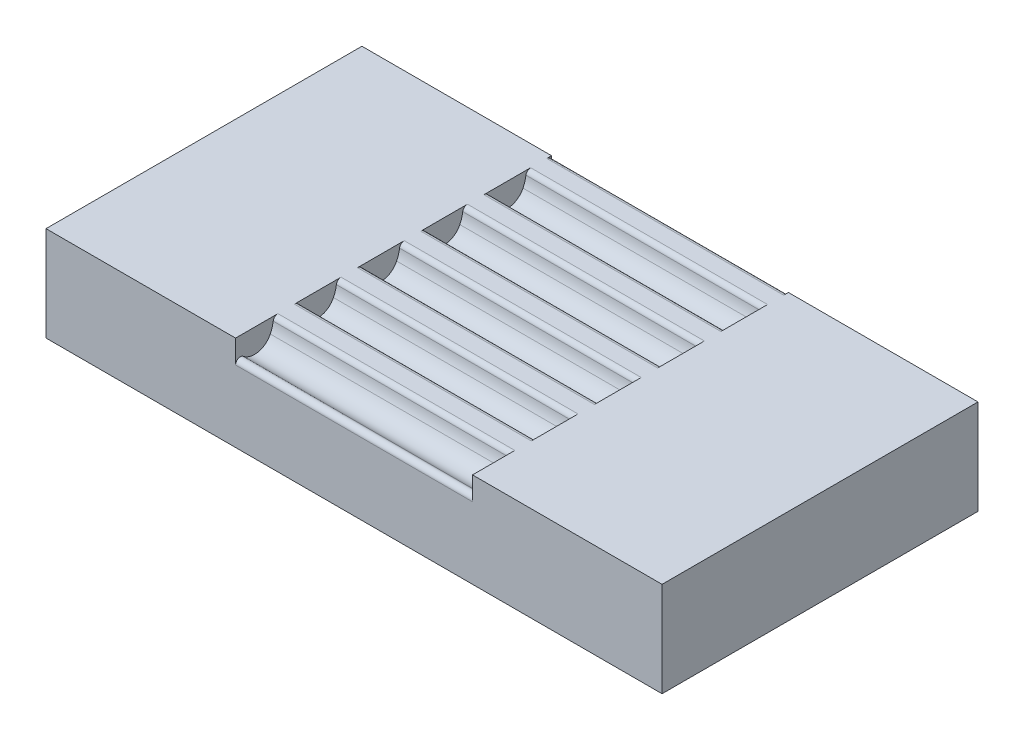
from build123d import *

# Parameters (mm, degrees)
SKETCH2_W           = 10
SKETCH2_H           = 3
BOSS_EXTRUDE1_DEPTH = 7.5
CUT_EXTRUDE2_DEPTH  = 13.854960132
LPATTERN2_COUNT     = 10
LPATTERN2_PITCH     = 2
FILLET2_START       = -1
FILLET2_DEPTH       = 9
SKETCH3_W           = 10
SKETCH3_H           = 3
BOSS_EXTRUDE2_DEPTH = 6


with BuildPart() as part:
    # Sketch2 → Boss-Extrude1 (new body)
    with BuildSketch(Plane(origin=(0, 0, 0), x_dir=(0, 0, -1), z_dir=(1, 0, 0))):
        with Locations((5, -1.5)):
            Rectangle(SKETCH2_W, SKETCH2_H)
    extrude(amount=BOSS_EXTRUDE1_DEPTH)

    # Sketch1 → Cut-Extrude2 (cut, through all)
    with BuildSketch(Plane(origin=(0, 0, 0), x_dir=(0, 0, -1), z_dir=(1, 0, 0))):
        with BuildLine():
            ThreePointArc((0.10112359, -0.438202237), (0.045620517, -0.221237163), (0.080384758, 0))
            Line((0.080384758, 0), (0, 0))
            ThreePointArc((0, 0), (0.025608803, -0.224859501), (0.10112359, -0.438202237))
        make_face()
        with BuildLine():
            ThreePointArc((1.155, -0.195), (1.146082164, -0.095907769), (1.119615242, 0))
            Line((1.119615242, 0), (0.080384758, 0))
            ThreePointArc((0.080384758, 0), (0.045620517, -0.221237163), (0.10112359, -0.438202237))
            ThreePointArc((0.10112359, -0.438202237), (0.6, -0.75), (1.09887641, -0.438202237))
            ThreePointArc((1.09887641, -0.438202237), (1.140787115, -0.319797021), (1.155, -0.195))
        make_face()
        with BuildLine():
            Line((0.080384758, 0), (1.119615242, 0))
            ThreePointArc((1.119615242, 0), (0.6, 0.36), (0.080384758, 0))
        make_face()
        with BuildLine():
            ThreePointArc((1.09887641, -0.438202237), (1.174391197, -0.224859501), (1.2, 0))
            Line((1.2, 0), (1.119615242, 0))
            ThreePointArc((1.119615242, 0), (1.146082164, -0.095907769), (1.155, -0.195))
            ThreePointArc((1.155, -0.195), (1.140787115, -0.319797021), (1.09887641, -0.438202237))
        make_face()
    cut_extrude2 = extrude(amount=CUT_EXTRUDE2_DEPTH, mode=Mode.SUBTRACT)

    # LPattern2: Cut-Extrude2 ×10
    with Locations(*[(0, 0, -i * LPATTERN2_PITCH) for i in range(1, LPATTERN2_COUNT)]):
        add(cut_extrude2, mode=Mode.SUBTRACT)

    # Fillet2: read off the stored shape, not the designer's step
    # Fillet2 outline → Fillet2 (cut)
    with BuildSketch(Plane.YZ.offset(FILLET2_START)):
        with BuildLine():
            Line((0, -10), (0, -9.85))
            ThreePointArc((0, -9.85), (-0.043933983, -9.956066017), (-0.15, -10))
            Line((-0.15, -10), (0, -10))
        make_face()
        with BuildLine():
            ThreePointArc((-0.130434783, -9.191456891), (-0.037228588, -9.241268354), (0, -9.340175425))
            Line((0, -9.340175425), (0, -9.2))
            ThreePointArc((0, -9.2), (-0.065357129, -9.197861937), (-0.130434783, -9.191456891))
        make_face()
        with BuildLine():
            Line((0, -8), (0, -7.859824575))
            ThreePointArc((0, -7.859824575), (-0.037228588, -7.958731646), (-0.130434783, -8.008543109))
            ThreePointArc((-0.130434783, -8.008543109), (-0.065357129, -8.002138063), (0, -8))
        make_face()
        with BuildLine():
            ThreePointArc((-0.130434783, -7.191456891), (-0.037228588, -7.241268354), (0, -7.340175425))
            Line((0, -7.340175425), (0, -7.2))
            ThreePointArc((0, -7.2), (-0.065357129, -7.197861937), (-0.130434783, -7.191456891))
        make_face()
        with BuildLine():
            Line((0, -6), (0, -5.859824575))
            ThreePointArc((0, -5.859824575), (-0.037228588, -5.958731646), (-0.130434783, -6.008543109))
            ThreePointArc((-0.130434783, -6.008543109), (-0.065357129, -6.002138063), (0, -6))
        make_face()
        with BuildLine():
            ThreePointArc((-0.130434783, -5.191456891), (-0.037228588, -5.241268354), (0, -5.340175425))
            Line((0, -5.340175425), (0, -5.2))
            ThreePointArc((0, -5.2), (-0.065357129, -5.197861937), (-0.130434783, -5.191456891))
        make_face()
        with BuildLine():
            Line((0, -4), (0, -3.859824575))
            ThreePointArc((0, -3.859824575), (-0.037228588, -3.958731646), (-0.130434783, -4.008543109))
            ThreePointArc((-0.130434783, -4.008543109), (-0.065357129, -4.002138063), (0, -4))
        make_face()
        with BuildLine():
            ThreePointArc((-0.130434783, -3.191456891), (-0.037228588, -3.241268354), (0, -3.340175425))
            Line((0, -3.340175425), (0, -3.2))
            ThreePointArc((0, -3.2), (-0.065357129, -3.197861937), (-0.130434783, -3.191456891))
        make_face()
        with BuildLine():
            Line((0, -2), (0, -1.859824575))
            ThreePointArc((0, -1.859824575), (-0.037228588, -1.958731646), (-0.130434783, -2.008543109))
            ThreePointArc((-0.130434783, -2.008543109), (-0.065357129, -2.002138063), (0, -2))
        make_face()
        with BuildLine():
            ThreePointArc((-0.737701575, 0), (-0.601941305, -0.086210119), (-0.622233155, -0.245744681))
            ThreePointArc((-0.622233155, -0.245744681), (-0.537928158, -0.163622551), (-0.438202247, -0.101123596))
            ThreePointArc((-0.438202247, -0.101123596), (-0.224859507, -0.025608804), (0, 0))
            Line((0, 0), (-0.737701575, 0))
        make_face()
        with BuildLine():
            ThreePointArc((-0.130434783, -1.191456891), (-0.037228588, -1.241268354), (0, -1.340175425))
            Line((0, -1.340175425), (0, -1.2))
            ThreePointArc((0, -1.2), (-0.065357129, -1.197861937), (-0.130434783, -1.191456891))
        make_face()
    extrude(amount=FILLET2_DEPTH, mode=Mode.SUBTRACT)

    # Sketch3 → Boss-Extrude2 (add)
    with BuildSketch(Plane(origin=(7.5, 0, 0), x_dir=(0, 0, -1), z_dir=(1, 0, 0))):
        with Locations((5, -1.5)):
            Rectangle(SKETCH3_W, SKETCH3_H)
    boss_extrude2 = extrude(amount=BOSS_EXTRUDE2_DEPTH)

    # Mirror1: Boss-Extrude2 across plane
    add(boss_extrude2.mirror(Plane.ZY.offset(-3.75)))


solid = part.part
